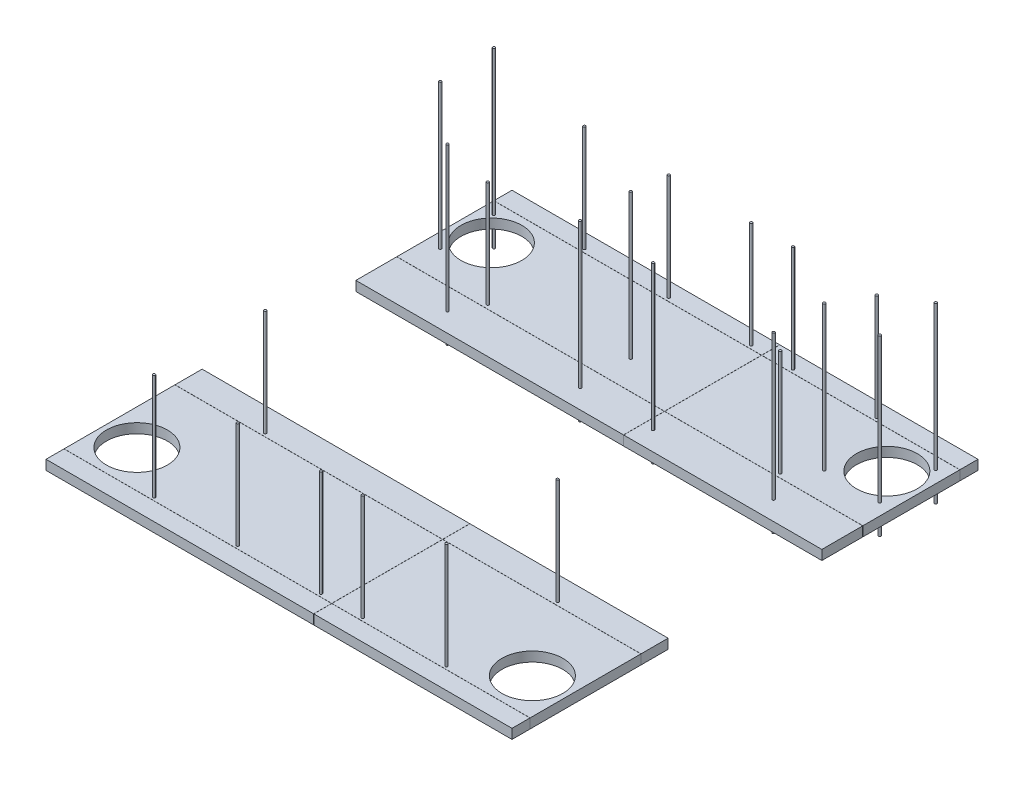
from build123d import *

# Parameters (mm, degrees)
SKETCH1_W                        = 4908.55
SKETCH1_H                        = 4908.55
BOSS_EXTRUDE1_DEPTH              = 101.6
SKETCH2_W                        = 4908.55
SKETCH2_H                        = 1619.25
CUT_EXTRUDE1_DEPTH               = 3473.355700566
SKETCH4_W                        = 4908.55
SKETCH4_H                        = 1.27
CUT_EXTRUDE_THIN1_DEPTH          = 3473.355700566
CUT_EXTRUDE_THIN2_DEPTH          = 3473.355700566
CUT_EXTRUDE_THIN2_DEPTH_BACK     = 3473.355700566
SKETCH5_W                        = 1.27
SKETCH5_H                        = 4908.55
SKETCH6_R                        = 320.675
CUT_EXTRUDE2_DEPTH               = 3473.355700566
STUD_LAYOUT_SKETCH_DEPTH         = 1524
STUD_LAYOUT_SKETCH_DEPTH_BACK    = 304.8
SKETCH7_R                        = 12.7
STUD_LAYOUT_SKETCH_2_DEPTH       = 1524
STUD_LAYOUT_SKETCH_2_DEPTH_BACK  = 304.8
STUD_LAYOUT_SKETCH_3_DEPTH       = 1524
STUD_LAYOUT_SKETCH_3_DEPTH_BACK  = 304.8
STUD_LAYOUT_SKETCH_4_DEPTH       = 1524
STUD_LAYOUT_SKETCH_4_DEPTH_BACK  = 304.8
STUD_LAYOUT_SKETCH_5_DEPTH       = 1524
STUD_LAYOUT_SKETCH_5_DEPTH_BACK  = 304.8
STUD_LAYOUT_SKETCH_6_DEPTH       = 1524
STUD_LAYOUT_SKETCH_6_DEPTH_BACK  = 304.8
STUD_LAYOUT_SKETCH_7_DEPTH       = 1524
STUD_LAYOUT_SKETCH_7_DEPTH_BACK  = 304.8
STUD_LAYOUT_SKETCH_8_DEPTH       = 1524
STUD_LAYOUT_SKETCH_8_DEPTH_BACK  = 304.8
STUD_LAYOUT_SKETCH_9_DEPTH       = 1524
STUD_LAYOUT_SKETCH_9_DEPTH_BACK  = 304.8
STUD_LAYOUT_SKETCH_10_DEPTH      = 1524
STUD_LAYOUT_SKETCH_10_DEPTH_BACK = 304.8
STUD_LAYOUT_SKETCH_11_DEPTH      = 1524
STUD_LAYOUT_SKETCH_11_DEPTH_BACK = 304.8
STUD_LAYOUT_SKETCH_12_DEPTH      = 1524
STUD_LAYOUT_SKETCH_12_DEPTH_BACK = 304.8
STUD_LAYOUT_SKETCH_13_DEPTH      = 1524
STUD_LAYOUT_SKETCH_13_DEPTH_BACK = 304.8
STUD_LAYOUT_SKETCH_14_DEPTH      = 1524
STUD_LAYOUT_SKETCH_14_DEPTH_BACK = 304.8
STUD_LAYOUT_SKETCH_15_DEPTH      = 1524
STUD_LAYOUT_SKETCH_15_DEPTH_BACK = 304.8
STUD_LAYOUT_SKETCH_16_DEPTH      = 1524
STUD_LAYOUT_SKETCH_16_DEPTH_BACK = 304.8
STUD_LAYOUT_SKETCH_17_DEPTH      = 1524
STUD_LAYOUT_SKETCH_17_DEPTH_BACK = 304.8
STUD_LAYOUT_SKETCH_18_DEPTH      = 1524
STUD_LAYOUT_SKETCH_18_DEPTH_BACK = 304.8
STUD_LAYOUT_SKETCH_19_DEPTH      = 1524
STUD_LAYOUT_SKETCH_19_DEPTH_BACK = 304.8
STUD_LAYOUT_SKETCH_20_DEPTH      = 1524
STUD_LAYOUT_SKETCH_20_DEPTH_BACK = 304.8
STUD_LAYOUT_SKETCH_21_DEPTH      = 1524
STUD_LAYOUT_SKETCH_21_DEPTH_BACK = 304.8
STUD_LAYOUT_SKETCH_22_DEPTH      = 1524
STUD_LAYOUT_SKETCH_22_DEPTH_BACK = 304.8
STUD_LAYOUT_SKETCH_23_DEPTH      = 1524
STUD_LAYOUT_SKETCH_23_DEPTH_BACK = 304.8
STUD_LAYOUT_SKETCH_24_DEPTH      = 1524
STUD_LAYOUT_SKETCH_24_DEPTH_BACK = 304.8
SKETCH8_W                        = 5497.787174958
SKETCH8_H                        = 7518.420007062
CUT_EXTRUDE5_DEPTH               = 406.4
SKETCH9_W                        = 5184.868781488
SKETCH9_H                        = 7370.4919608
CUT_EXTRUDE6_DEPTH               = 254


with BuildPart() as part:
    # Sketch1 → Boss-Extrude1 (new body)
    with BuildSketch(Plane(origin=(0, 0, 0), x_dir=(1, 0, 0), z_dir=(0, 1, 0))):
        Rectangle(SKETCH1_W, SKETCH1_H)
    extrude(amount=BOSS_EXTRUDE1_DEPTH)

    # Sketch2 → Cut-Extrude1 (cut, through all)
    with BuildSketch(Plane(origin=(0, 101.6, 0), x_dir=(1, 0, 0), z_dir=(0, 1, 0))):
        Rectangle(SKETCH2_W, SKETCH2_H)
    extrude(amount=-CUT_EXTRUDE1_DEPTH, mode=Mode.SUBTRACT)


with BuildPart() as cut_extrude1_piece_1:
    # of the separate pieces the step leaves, piece 1, a body of its own (cut_extrude1_pieces)
    add(part.part.solids().sort_by_distance((-2454.275, 0, -2454.275))[0])


with BuildPart() as cut_extrude1_piece_2:
    # of the separate pieces the step leaves, piece 2, a body of its own (cut_extrude1_pieces)
    add(part.part.solids().sort_by_distance((-2454.275, 0, 2454.275))[0])


with BuildPart() as cut_extrude_thin1_tool:
    # Sketch4 → Cut-Extrude-Thin1 (new, through all)
    with BuildSketch(Plane(origin=(0, 101.6, 0), x_dir=(1, 0, 0), z_dir=(0, 1, 0))):
        with Locations((0, -2264.41)):
            Rectangle(SKETCH4_W, SKETCH4_H)
        with Locations((0, -1096.01)):
            Rectangle(SKETCH4_W, SKETCH4_H)
        with Locations((0, 2263.14)):
            Rectangle(SKETCH4_W, SKETCH4_H)
        with Locations((0, 1240.79)):
            Rectangle(SKETCH4_W, SKETCH4_H)
    extrude(amount=-CUT_EXTRUDE_THIN1_DEPTH)


with BuildPart() as cut_extrude1_piece_1_1:
    add(cut_extrude1_piece_1.part)

    # Cut-Extrude-Thin1: cut by cut_extrude_thin1_tool
    add(cut_extrude_thin1_tool.part, mode=Mode.SUBTRACT)


with BuildPart() as cut_extrude1_piece_2_1:
    add(cut_extrude1_piece_2.part)

    # Cut-Extrude-Thin1: cut by cut_extrude_thin1_tool
    add(cut_extrude_thin1_tool.part, mode=Mode.SUBTRACT)


with BuildPart() as cut_extrude_thin1_piece_1:
    # of the separate pieces the step leaves, piece 1, a body of its own (cut_extrude_thin1_pieces)
    add(cut_extrude1_piece_1_1.part.solids().sort_by_distance((-2454.275, 0, -1241.425))[0])


with BuildPart() as cut_extrude_thin1_piece_2:
    # of the separate pieces the step leaves, piece 2, a body of its own (cut_extrude_thin1_pieces)
    add(cut_extrude1_piece_1_1.part.solids().sort_by_distance((-2454.275, 0, -809.625))[0])


with BuildPart() as cut_extrude_thin1_piece_3:
    # of the separate pieces the step leaves, piece 3, a body of its own (cut_extrude_thin1_pieces)
    add(cut_extrude1_piece_1_1.part.solids().sort_by_distance((-2454.275, 0, -2454.275))[0])


with BuildPart() as cut_extrude_thin1_piece_1_of_cut_extrude:
    # of the separate pieces the step leaves, piece 1, a body of its own (cut_extrude_thin1_pieces_of_cut_extrude1)
    add(cut_extrude1_piece_2_1.part.solids().sort_by_distance((-2454.275, 0, 2263.775))[0])


with BuildPart() as cut_extrude_thin1_piece_2_of_cut_extrude:
    # of the separate pieces the step leaves, piece 2, a body of its own (cut_extrude_thin1_pieces_of_cut_extrude1)
    add(cut_extrude1_piece_2_1.part.solids().sort_by_distance((-2454.275, 0, 1095.375))[0])


with BuildPart() as cut_extrude_thin1_piece_3_of_cut_extrude:
    # of the separate pieces the step leaves, piece 3, a body of its own (cut_extrude_thin1_pieces_of_cut_extrude1)
    add(cut_extrude1_piece_2_1.part.solids().sort_by_distance((-2454.275, 0, 2454.275))[0])


with BuildPart() as cut_extrude_thin2_tool:
    # Sketch5 → Cut-Extrude-Thin2 (new, two sides: drawn at the far end of the back side and taken through both)
    with BuildSketch(Plane(origin=(0, 101.6, 0), x_dir=(1, 0, 0), z_dir=(0, 1, 0)).offset(-CUT_EXTRUDE_THIN2_DEPTH_BACK)):
        with Locations((365.76, 0)):
            Rectangle(SKETCH5_W, SKETCH5_H)
    extrude(amount=CUT_EXTRUDE_THIN2_DEPTH + CUT_EXTRUDE_THIN2_DEPTH_BACK)


with BuildPart() as cut_extrude_thin1_piece_1_1:
    add(cut_extrude_thin1_piece_1.part)

    # Cut-Extrude-Thin2: cut by cut_extrude_thin2_tool
    add(cut_extrude_thin2_tool.part, mode=Mode.SUBTRACT)


with BuildPart() as cut_extrude_thin1_piece_2_1:
    add(cut_extrude_thin1_piece_2.part)

    # Cut-Extrude-Thin2: cut by cut_extrude_thin2_tool
    add(cut_extrude_thin2_tool.part, mode=Mode.SUBTRACT)


with BuildPart() as cut_extrude_thin1_piece_3_1:
    add(cut_extrude_thin1_piece_3.part)

    # Cut-Extrude-Thin2: cut by cut_extrude_thin2_tool
    add(cut_extrude_thin2_tool.part, mode=Mode.SUBTRACT)


with BuildPart() as cut_extrude_thin1_piece_1_of_cut_extrude_1:
    add(cut_extrude_thin1_piece_1_of_cut_extrude.part)

    # Cut-Extrude-Thin2: cut by cut_extrude_thin2_tool
    add(cut_extrude_thin2_tool.part, mode=Mode.SUBTRACT)


with BuildPart() as cut_extrude_thin1_piece_2_of_cut_extrude_1:
    add(cut_extrude_thin1_piece_2_of_cut_extrude.part)

    # Cut-Extrude-Thin2: cut by cut_extrude_thin2_tool
    add(cut_extrude_thin2_tool.part, mode=Mode.SUBTRACT)


with BuildPart() as cut_extrude_thin1_piece_3_of_cut_extrude_1:
    add(cut_extrude_thin1_piece_3_of_cut_extrude.part)

    # Cut-Extrude-Thin2: cut by cut_extrude_thin2_tool
    add(cut_extrude_thin2_tool.part, mode=Mode.SUBTRACT)


with BuildPart() as cut_extrude_thin2_piece_1:
    # of the separate pieces the step leaves, piece 1, a body of its own (cut_extrude_thin2_pieces)
    add(cut_extrude_thin1_piece_1_1.part.solids().sort_by_distance((-2454.275, 0, -1241.425))[0])


with BuildPart() as cut_extrude_thin2_piece_2:
    # of the separate pieces the step leaves, piece 2, a body of its own (cut_extrude_thin2_pieces)
    add(cut_extrude_thin1_piece_1_1.part.solids().sort_by_distance((2454.275, 0, -2262.505))[0])


with BuildPart() as cut_extrude_thin2_piece_1_of_cut_extrude:
    # of the separate pieces the step leaves, piece 1, a body of its own (cut_extrude_thin2_pieces_of_cut_extrude)
    add(cut_extrude_thin1_piece_2_1.part.solids().sort_by_distance((-2454.275, 0, -809.625))[0])


with BuildPart() as cut_extrude_thin2_piece_2_of_cut_extrude:
    # of the separate pieces the step leaves, piece 2, a body of its own (cut_extrude_thin2_pieces_of_cut_extrude)
    add(cut_extrude_thin1_piece_2_1.part.solids().sort_by_distance((2454.275, 0, -1240.155))[0])


with BuildPart() as cut_extrude_thin2_piece_1_of_cut_ext_2:
    # of the separate pieces the step leaves, piece 1, a body of its own (cut_extrude_thin2_pieces_of_cut_extr_2)
    add(cut_extrude_thin1_piece_3_1.part.solids().sort_by_distance((-2454.275, 0, -2454.275))[0])


with BuildPart() as cut_extrude_thin2_piece_2_of_cut_ext_2:
    # of the separate pieces the step leaves, piece 2, a body of its own (cut_extrude_thin2_pieces_of_cut_extr_2)
    add(cut_extrude_thin1_piece_3_1.part.solids().sort_by_distance((366.395, 0, -2454.275))[0])


with BuildPart() as cut_extrude_thin2_piece_1_of_cut_ext_3:
    # of the separate pieces the step leaves, piece 1, a body of its own (cut_extrude_thin2_pieces_of_cut_extr_3)
    add(cut_extrude_thin1_piece_1_of_cut_extrude_1.part.solids().sort_by_distance((-2454.275, 0, 2263.775))[0])


with BuildPart() as cut_extrude_thin2_piece_2_of_cut_ext_3:
    # of the separate pieces the step leaves, piece 2, a body of its own (cut_extrude_thin2_pieces_of_cut_extr_3)
    add(cut_extrude_thin1_piece_1_of_cut_extrude_1.part.solids().sort_by_distance((2454.275, 0, 1096.645))[0])


with BuildPart() as cut_extrude_thin2_piece_1_of_cut_ext_4:
    # of the separate pieces the step leaves, piece 1, a body of its own (cut_extrude_thin2_pieces_of_cut_extr_4)
    add(cut_extrude_thin1_piece_2_of_cut_extrude_1.part.solids().sort_by_distance((-2454.275, 0, 1095.375))[0])


with BuildPart() as cut_extrude_thin2_piece_2_of_cut_ext_4:
    # of the separate pieces the step leaves, piece 2, a body of its own (cut_extrude_thin2_pieces_of_cut_extr_4)
    add(cut_extrude_thin1_piece_2_of_cut_extrude_1.part.solids().sort_by_distance((2454.275, 0, 809.625))[0])


with BuildPart() as cut_extrude_thin2_piece_1_of_cut_ext_5:
    # of the separate pieces the step leaves, piece 1, a body of its own (cut_extrude_thin2_pieces_of_cut_extr_5)
    add(cut_extrude_thin1_piece_3_of_cut_extrude_1.part.solids().sort_by_distance((-2454.275, 0, 2454.275))[0])


with BuildPart() as cut_extrude_thin2_piece_2_of_cut_ext_5:
    # of the separate pieces the step leaves, piece 2, a body of its own (cut_extrude_thin2_pieces_of_cut_extr_5)
    add(cut_extrude_thin1_piece_3_of_cut_extrude_1.part.solids().sort_by_distance((2454.275, 0, 2265.045))[0])


with BuildPart() as cut_extrude2_tool:
    # Sketch6 → Cut-Extrude2 (new, through all)
    with BuildSketch(Plane(origin=(0, 101.6, 0), x_dir=(1, 0, 0), z_dir=(0, 1, 0))):
        with Locations((2082.8, 1865.63)):
            Circle(SKETCH6_R)
        with Locations((-2082.8, 1865.63)):
            Circle(SKETCH6_R)
        with Locations((-2082.8, -1868.17)):
            Circle(SKETCH6_R)
        with Locations((2082.8, -1868.17)):
            Circle(SKETCH6_R)
    extrude(amount=-CUT_EXTRUDE2_DEPTH)


with BuildPart() as cut_extrude_thin2_piece_1_1:
    add(cut_extrude_thin2_piece_1.part)

    # Cut-Extrude2: cut by cut_extrude2_tool
    add(cut_extrude2_tool.part, mode=Mode.SUBTRACT)


with BuildPart() as cut_extrude_thin2_piece_2_1:
    add(cut_extrude_thin2_piece_2.part)

    # Cut-Extrude2: cut by cut_extrude2_tool
    add(cut_extrude2_tool.part, mode=Mode.SUBTRACT)


with BuildPart() as cut_extrude_thin2_piece_1_of_cut_ext_3_1:
    add(cut_extrude_thin2_piece_1_of_cut_ext_3.part)

    # Cut-Extrude2: cut by cut_extrude2_tool
    add(cut_extrude2_tool.part, mode=Mode.SUBTRACT)


with BuildPart() as cut_extrude_thin2_piece_2_of_cut_ext_3_1:
    add(cut_extrude_thin2_piece_2_of_cut_ext_3.part)

    # Cut-Extrude2: cut by cut_extrude2_tool
    add(cut_extrude2_tool.part, mode=Mode.SUBTRACT)


with BuildPart() as body_13:
    # Sketch7 → STUD LAYOUT SKETCH (new, two sides: drawn at the far end of the back side and taken through both)
    with BuildSketch(Plane(origin=(0, 101.6, 0), x_dir=(1, 0, 0), z_dir=(0, 1, 0)).offset(-STUD_LAYOUT_SKETCH_DEPTH_BACK)):
        with Locations((-1539.875, 2301.875)):
            Circle(SKETCH7_R)
    extrude(amount=STUD_LAYOUT_SKETCH_DEPTH + STUD_LAYOUT_SKETCH_DEPTH_BACK)


with BuildPart() as body_14:
    # Sketch7 → STUD LAYOUT SKETCH 2 (new, two sides: drawn at the far end of the back side and taken through both)
    with BuildSketch(Plane(origin=(0, 101.6, 0), x_dir=(1, 0, 0), z_dir=(0, 1, 0)).offset(-STUD_LAYOUT_SKETCH_2_DEPTH_BACK)):
        with Locations((1743.075, 1546.225)):
            Circle(SKETCH7_R)
    extrude(amount=STUD_LAYOUT_SKETCH_2_DEPTH + STUD_LAYOUT_SKETCH_2_DEPTH_BACK)


with BuildPart() as body_15:
    # Sketch7 → STUD LAYOUT SKETCH 3 (new, two sides: drawn at the far end of the back side and taken through both)
    with BuildSketch(Plane(origin=(0, 101.6, 0), x_dir=(1, 0, 0), z_dir=(0, 1, 0)).offset(-STUD_LAYOUT_SKETCH_3_DEPTH_BACK)):
        with Locations((473.075, 1012.825)):
            Circle(SKETCH7_R)
    extrude(amount=STUD_LAYOUT_SKETCH_3_DEPTH + STUD_LAYOUT_SKETCH_3_DEPTH_BACK)


with BuildPart() as body_16:
    # Sketch7 → STUD LAYOUT SKETCH 4 (new, two sides: drawn at the far end of the back side and taken through both)
    with BuildSketch(Plane(origin=(0, 101.6, 0), x_dir=(1, 0, 0), z_dir=(0, 1, 0)).offset(-STUD_LAYOUT_SKETCH_4_DEPTH_BACK)):
        with Locations((-295.275, 1546.225)):
            Circle(SKETCH7_R)
    extrude(amount=STUD_LAYOUT_SKETCH_4_DEPTH + STUD_LAYOUT_SKETCH_4_DEPTH_BACK)


with BuildPart() as body_17:
    # Sketch7 → STUD LAYOUT SKETCH 5 (new, two sides: drawn at the far end of the back side and taken through both)
    with BuildSketch(Plane(origin=(0, 101.6, 0), x_dir=(1, 0, 0), z_dir=(0, 1, 0)).offset(-STUD_LAYOUT_SKETCH_5_DEPTH_BACK)):
        with Locations((-295.275, 1012.825)):
            Circle(SKETCH7_R)
    extrude(amount=STUD_LAYOUT_SKETCH_5_DEPTH + STUD_LAYOUT_SKETCH_5_DEPTH_BACK)


with BuildPart() as body_18:
    # Sketch7 → STUD LAYOUT SKETCH 6 (new, two sides: drawn at the far end of the back side and taken through both)
    with BuildSketch(Plane(origin=(0, 101.6, 0), x_dir=(1, 0, 0), z_dir=(0, 1, 0)).offset(-STUD_LAYOUT_SKETCH_6_DEPTH_BACK)):
        with Locations((-1692.275, 1012.825)):
            Circle(SKETCH7_R)
    extrude(amount=STUD_LAYOUT_SKETCH_6_DEPTH + STUD_LAYOUT_SKETCH_6_DEPTH_BACK)


with BuildPart() as body_19:
    # Sketch7 → STUD LAYOUT SKETCH 7 (new, two sides: drawn at the far end of the back side and taken through both)
    with BuildSketch(Plane(origin=(0, 101.6, 0), x_dir=(1, 0, 0), z_dir=(0, 1, 0)).offset(-STUD_LAYOUT_SKETCH_7_DEPTH_BACK)):
        with Locations((1743.075, 1012.825)):
            Circle(SKETCH7_R)
    extrude(amount=STUD_LAYOUT_SKETCH_7_DEPTH + STUD_LAYOUT_SKETCH_7_DEPTH_BACK)


with BuildPart() as body_20:
    # Sketch7 → STUD LAYOUT SKETCH 8 (new, two sides: drawn at the far end of the back side and taken through both)
    with BuildSketch(Plane(origin=(0, 101.6, 0), x_dir=(1, 0, 0), z_dir=(0, 1, 0)).offset(-STUD_LAYOUT_SKETCH_8_DEPTH_BACK)):
        with Locations((-2301.875, 1546.225)):
            Circle(SKETCH7_R)
    extrude(amount=STUD_LAYOUT_SKETCH_8_DEPTH + STUD_LAYOUT_SKETCH_8_DEPTH_BACK)


with BuildPart() as body_21:
    # Sketch7 → STUD LAYOUT SKETCH 9 (new, two sides: drawn at the far end of the back side and taken through both)
    with BuildSketch(Plane(origin=(0, 101.6, 0), x_dir=(1, 0, 0), z_dir=(0, 1, 0)).offset(-STUD_LAYOUT_SKETCH_9_DEPTH_BACK)):
        with Locations((2327.275, 1546.225)):
            Circle(SKETCH7_R)
    extrude(amount=STUD_LAYOUT_SKETCH_9_DEPTH + STUD_LAYOUT_SKETCH_9_DEPTH_BACK)


with BuildPart() as body_22:
    # Sketch7 → STUD LAYOUT SKETCH 10 (new, two sides: drawn at the far end of the back side and taken through both)
    with BuildSketch(Plane(origin=(0, 101.6, 0), x_dir=(1, 0, 0), z_dir=(0, 1, 0)).offset(-STUD_LAYOUT_SKETCH_10_DEPTH_BACK)):
        with Locations((-2327.275, 2136.775)):
            Circle(SKETCH7_R)
    extrude(amount=STUD_LAYOUT_SKETCH_10_DEPTH + STUD_LAYOUT_SKETCH_10_DEPTH_BACK)


with BuildPart() as body_23:
    # Sketch7 → STUD LAYOUT SKETCH 11 (new, two sides: drawn at the far end of the back side and taken through both)
    with BuildSketch(Plane(origin=(0, 101.6, 0), x_dir=(1, 0, 0), z_dir=(0, 1, 0)).offset(-STUD_LAYOUT_SKETCH_11_DEPTH_BACK)):
        with Locations((2327.275, 2136.775)):
            Circle(SKETCH7_R)
    extrude(amount=STUD_LAYOUT_SKETCH_11_DEPTH + STUD_LAYOUT_SKETCH_11_DEPTH_BACK)


with BuildPart() as body_24:
    # Sketch7 → STUD LAYOUT SKETCH 12 (new, two sides: drawn at the far end of the back side and taken through both)
    with BuildSketch(Plane(origin=(0, 101.6, 0), x_dir=(1, 0, 0), z_dir=(0, 1, 0)).offset(-STUD_LAYOUT_SKETCH_12_DEPTH_BACK)):
        with Locations((219.075, 2301.875)):
            Circle(SKETCH7_R)
    extrude(amount=STUD_LAYOUT_SKETCH_12_DEPTH + STUD_LAYOUT_SKETCH_12_DEPTH_BACK)


with BuildPart() as body_25:
    # Sketch7 → STUD LAYOUT SKETCH 13 (new, two sides: drawn at the far end of the back side and taken through both)
    with BuildSketch(Plane(origin=(0, 101.6, 0), x_dir=(1, 0, 0), z_dir=(0, 1, 0)).offset(-STUD_LAYOUT_SKETCH_13_DEPTH_BACK)):
        with Locations((658.495, 2301.875)):
            Circle(SKETCH7_R)
    extrude(amount=STUD_LAYOUT_SKETCH_13_DEPTH + STUD_LAYOUT_SKETCH_13_DEPTH_BACK)


with BuildPart() as body_26:
    # Sketch7 → STUD LAYOUT SKETCH 14 (new, two sides: drawn at the far end of the back side and taken through both)
    with BuildSketch(Plane(origin=(0, 101.6, 0), x_dir=(1, 0, 0), z_dir=(0, 1, 0)).offset(-STUD_LAYOUT_SKETCH_14_DEPTH_BACK)):
        with Locations((1539.875, 2301.875)):
            Circle(SKETCH7_R)
    extrude(amount=STUD_LAYOUT_SKETCH_14_DEPTH + STUD_LAYOUT_SKETCH_14_DEPTH_BACK)


with BuildPart() as body_27:
    # Sketch7 → STUD LAYOUT SKETCH 15 (new, two sides: drawn at the far end of the back side and taken through both)
    with BuildSketch(Plane(origin=(0, 101.6, 0), x_dir=(1, 0, 0), z_dir=(0, 1, 0)).offset(-STUD_LAYOUT_SKETCH_15_DEPTH_BACK)):
        with Locations((-650.875, 2301.875)):
            Circle(SKETCH7_R)
    extrude(amount=STUD_LAYOUT_SKETCH_15_DEPTH + STUD_LAYOUT_SKETCH_15_DEPTH_BACK)


with BuildPart() as body_28:
    # Sketch7 → STUD LAYOUT SKETCH 16 (new, two sides: drawn at the far end of the back side and taken through both)
    with BuildSketch(Plane(origin=(0, 101.6, 0), x_dir=(1, 0, 0), z_dir=(0, 1, 0)).offset(-STUD_LAYOUT_SKETCH_16_DEPTH_BACK)):
        with Locations((-1539.875, 1285.875)):
            Circle(SKETCH7_R)
    extrude(amount=STUD_LAYOUT_SKETCH_16_DEPTH + STUD_LAYOUT_SKETCH_16_DEPTH_BACK)


with BuildPart() as body_29:
    # Sketch7 → STUD LAYOUT SKETCH 17 (new, two sides: drawn at the far end of the back side and taken through both)
    with BuildSketch(Plane(origin=(0, 101.6, 0), x_dir=(1, 0, 0), z_dir=(0, 1, 0)).offset(-STUD_LAYOUT_SKETCH_17_DEPTH_BACK)):
        with Locations((1539.875, 1285.875)):
            Circle(SKETCH7_R)
    extrude(amount=STUD_LAYOUT_SKETCH_17_DEPTH + STUD_LAYOUT_SKETCH_17_DEPTH_BACK)


with BuildPart() as body_30:
    # Sketch7 → STUD LAYOUT SKETCH 18 (new, two sides: drawn at the far end of the back side and taken through both)
    with BuildSketch(Plane(origin=(0, 101.6, 0), x_dir=(1, 0, 0), z_dir=(0, 1, 0)).offset(-STUD_LAYOUT_SKETCH_18_DEPTH_BACK)):
        with Locations((-1539.875, -1058.595975439)):
            Circle(SKETCH7_R)
    extrude(amount=STUD_LAYOUT_SKETCH_18_DEPTH + STUD_LAYOUT_SKETCH_18_DEPTH_BACK)


with BuildPart() as body_31:
    # Sketch7 → STUD LAYOUT SKETCH 19 (new, two sides: drawn at the far end of the back side and taken through both)
    with BuildSketch(Plane(origin=(0, 101.6, 0), x_dir=(1, 0, 0), z_dir=(0, 1, 0)).offset(-STUD_LAYOUT_SKETCH_19_DEPTH_BACK)):
        with Locations((-1539.875, -2230.249923642)):
            Circle(SKETCH7_R)
    extrude(amount=STUD_LAYOUT_SKETCH_19_DEPTH + STUD_LAYOUT_SKETCH_19_DEPTH_BACK)


with BuildPart() as body_32:
    # Sketch7 → STUD LAYOUT SKETCH 20 (new, two sides: drawn at the far end of the back side and taken through both)
    with BuildSketch(Plane(origin=(0, 101.6, 0), x_dir=(1, 0, 0), z_dir=(0, 1, 0)).offset(-STUD_LAYOUT_SKETCH_20_DEPTH_BACK)):
        with Locations((-658.765974284, -2230.249923642)):
            Circle(SKETCH7_R)
    extrude(amount=STUD_LAYOUT_SKETCH_20_DEPTH + STUD_LAYOUT_SKETCH_20_DEPTH_BACK)


with BuildPart() as body_33:
    # Sketch7 → STUD LAYOUT SKETCH 21 (new, two sides: drawn at the far end of the back side and taken through both)
    with BuildSketch(Plane(origin=(0, 101.6, 0), x_dir=(1, 0, 0), z_dir=(0, 1, 0)).offset(-STUD_LAYOUT_SKETCH_21_DEPTH_BACK)):
        with Locations((219.075, -2230.249923642)):
            Circle(SKETCH7_R)
    extrude(amount=STUD_LAYOUT_SKETCH_21_DEPTH + STUD_LAYOUT_SKETCH_21_DEPTH_BACK)


with BuildPart() as body_34:
    # Sketch7 → STUD LAYOUT SKETCH 22 (new, two sides: drawn at the far end of the back side and taken through both)
    with BuildSketch(Plane(origin=(0, 101.6, 0), x_dir=(1, 0, 0), z_dir=(0, 1, 0)).offset(-STUD_LAYOUT_SKETCH_22_DEPTH_BACK)):
        with Locations((658.495, -2230.249923642)):
            Circle(SKETCH7_R)
    extrude(amount=STUD_LAYOUT_SKETCH_22_DEPTH + STUD_LAYOUT_SKETCH_22_DEPTH_BACK)


with BuildPart() as body_35:
    # Sketch7 → STUD LAYOUT SKETCH 23 (new, two sides: drawn at the far end of the back side and taken through both)
    with BuildSketch(Plane(origin=(0, 101.6, 0), x_dir=(1, 0, 0), z_dir=(0, 1, 0)).offset(-STUD_LAYOUT_SKETCH_23_DEPTH_BACK)):
        with Locations((1539.875, -2230.249923642)):
            Circle(SKETCH7_R)
    extrude(amount=STUD_LAYOUT_SKETCH_23_DEPTH + STUD_LAYOUT_SKETCH_23_DEPTH_BACK)


with BuildPart() as body_36:
    # Sketch7 → STUD LAYOUT SKETCH 24 (new, two sides: drawn at the far end of the back side and taken through both)
    with BuildSketch(Plane(origin=(0, 101.6, 0), x_dir=(1, 0, 0), z_dir=(0, 1, 0)).offset(-STUD_LAYOUT_SKETCH_24_DEPTH_BACK)):
        with Locations((1539.875, -1058.595975439)):
            Circle(SKETCH7_R)
    extrude(amount=STUD_LAYOUT_SKETCH_24_DEPTH + STUD_LAYOUT_SKETCH_24_DEPTH_BACK)


with BuildPart() as cut_extrude5_tool:
    # Sketch8 → Cut-Extrude5 (new body)
    with BuildSketch(Plane(origin=(0, 1625.6, 0), x_dir=(1, 0, 0), z_dir=(0, 1, 0))):
        Rectangle(SKETCH8_W, SKETCH8_H)
    extrude(amount=-CUT_EXTRUDE5_DEPTH)


with BuildPart() as body_13_1:
    add(body_13.part)

    # Cut-Extrude5: cut by cut_extrude5_tool
    add(cut_extrude5_tool.part, mode=Mode.SUBTRACT)


with BuildPart() as body_24_1:
    add(body_24.part)

    # Cut-Extrude5: cut by cut_extrude5_tool
    add(cut_extrude5_tool.part, mode=Mode.SUBTRACT)


with BuildPart() as body_25_1:
    add(body_25.part)

    # Cut-Extrude5: cut by cut_extrude5_tool
    add(cut_extrude5_tool.part, mode=Mode.SUBTRACT)


with BuildPart() as body_26_1:
    add(body_26.part)

    # Cut-Extrude5: cut by cut_extrude5_tool
    add(cut_extrude5_tool.part, mode=Mode.SUBTRACT)


with BuildPart() as body_27_1:
    add(body_27.part)

    # Cut-Extrude5: cut by cut_extrude5_tool
    add(cut_extrude5_tool.part, mode=Mode.SUBTRACT)


with BuildPart() as body_28_1:
    add(body_28.part)

    # Cut-Extrude5: cut by cut_extrude5_tool
    add(cut_extrude5_tool.part, mode=Mode.SUBTRACT)


with BuildPart() as body_29_1:
    add(body_29.part)

    # Cut-Extrude5: cut by cut_extrude5_tool
    add(cut_extrude5_tool.part, mode=Mode.SUBTRACT)


with BuildPart() as body_30_1:
    add(body_30.part)

    # Cut-Extrude5: cut by cut_extrude5_tool
    add(cut_extrude5_tool.part, mode=Mode.SUBTRACT)


with BuildPart() as body_31_1:
    add(body_31.part)

    # Cut-Extrude5: cut by cut_extrude5_tool
    add(cut_extrude5_tool.part, mode=Mode.SUBTRACT)


with BuildPart() as body_32_1:
    add(body_32.part)

    # Cut-Extrude5: cut by cut_extrude5_tool
    add(cut_extrude5_tool.part, mode=Mode.SUBTRACT)


with BuildPart() as body_33_1:
    add(body_33.part)

    # Cut-Extrude5: cut by cut_extrude5_tool
    add(cut_extrude5_tool.part, mode=Mode.SUBTRACT)


with BuildPart() as body_34_1:
    add(body_34.part)

    # Cut-Extrude5: cut by cut_extrude5_tool
    add(cut_extrude5_tool.part, mode=Mode.SUBTRACT)


with BuildPart() as body_35_1:
    add(body_35.part)

    # Cut-Extrude5: cut by cut_extrude5_tool
    add(cut_extrude5_tool.part, mode=Mode.SUBTRACT)


with BuildPart() as body_36_1:
    add(body_36.part)

    # Cut-Extrude5: cut by cut_extrude5_tool
    add(cut_extrude5_tool.part, mode=Mode.SUBTRACT)


with BuildPart() as cut_extrude6_tool:
    # Sketch9 → Cut-Extrude6 (new body)
    with BuildSketch(Plane.XZ.offset(203.2)):
        Rectangle(SKETCH9_W, SKETCH9_H)
    extrude(amount=-CUT_EXTRUDE6_DEPTH)


with BuildPart() as body_13_2:
    add(body_13_1.part)

    # Cut-Extrude6: cut by cut_extrude6_tool
    add(cut_extrude6_tool.part, mode=Mode.SUBTRACT)


with BuildPart() as body_24_2:
    add(body_24_1.part)

    # Cut-Extrude6: cut by cut_extrude6_tool
    add(cut_extrude6_tool.part, mode=Mode.SUBTRACT)


with BuildPart() as body_25_2:
    add(body_25_1.part)

    # Cut-Extrude6: cut by cut_extrude6_tool
    add(cut_extrude6_tool.part, mode=Mode.SUBTRACT)


with BuildPart() as body_26_2:
    add(body_26_1.part)

    # Cut-Extrude6: cut by cut_extrude6_tool
    add(cut_extrude6_tool.part, mode=Mode.SUBTRACT)


with BuildPart() as body_27_2:
    add(body_27_1.part)

    # Cut-Extrude6: cut by cut_extrude6_tool
    add(cut_extrude6_tool.part, mode=Mode.SUBTRACT)


with BuildPart() as body_28_2:
    add(body_28_1.part)

    # Cut-Extrude6: cut by cut_extrude6_tool
    add(cut_extrude6_tool.part, mode=Mode.SUBTRACT)


with BuildPart() as body_29_2:
    add(body_29_1.part)

    # Cut-Extrude6: cut by cut_extrude6_tool
    add(cut_extrude6_tool.part, mode=Mode.SUBTRACT)


with BuildPart() as body_30_2:
    add(body_30_1.part)

    # Cut-Extrude6: cut by cut_extrude6_tool
    add(cut_extrude6_tool.part, mode=Mode.SUBTRACT)


with BuildPart() as body_31_2:
    add(body_31_1.part)

    # Cut-Extrude6: cut by cut_extrude6_tool
    add(cut_extrude6_tool.part, mode=Mode.SUBTRACT)


with BuildPart() as body_32_2:
    add(body_32_1.part)

    # Cut-Extrude6: cut by cut_extrude6_tool
    add(cut_extrude6_tool.part, mode=Mode.SUBTRACT)


with BuildPart() as body_33_2:
    add(body_33_1.part)

    # Cut-Extrude6: cut by cut_extrude6_tool
    add(cut_extrude6_tool.part, mode=Mode.SUBTRACT)


with BuildPart() as body_34_2:
    add(body_34_1.part)

    # Cut-Extrude6: cut by cut_extrude6_tool
    add(cut_extrude6_tool.part, mode=Mode.SUBTRACT)


with BuildPart() as body_35_2:
    add(body_35_1.part)

    # Cut-Extrude6: cut by cut_extrude6_tool
    add(cut_extrude6_tool.part, mode=Mode.SUBTRACT)


with BuildPart() as body_36_2:
    add(body_36_1.part)

    # Cut-Extrude6: cut by cut_extrude6_tool
    add(cut_extrude6_tool.part, mode=Mode.SUBTRACT)


solid = Compound([cut_extrude_thin2_piece_1_of_cut_extrude.part, cut_extrude_thin2_piece_2_of_cut_extrude.part, cut_extrude_thin2_piece_1_of_cut_ext_2.part, cut_extrude_thin2_piece_2_of_cut_ext_2.part, cut_extrude_thin2_piece_1_of_cut_ext_4.part, cut_extrude_thin2_piece_2_of_cut_ext_4.part, cut_extrude_thin2_piece_1_of_cut_ext_5.part, cut_extrude_thin2_piece_2_of_cut_ext_5.part, cut_extrude_thin2_piece_1_1.part, cut_extrude_thin2_piece_2_1.part, cut_extrude_thin2_piece_1_of_cut_ext_3_1.part, cut_extrude_thin2_piece_2_of_cut_ext_3_1.part, body_14.part, body_15.part, body_16.part, body_17.part, body_18.part, body_19.part, body_20.part, body_21.part, body_22.part, body_23.part, body_13_2.part, body_24_2.part, body_25_2.part, body_26_2.part, body_27_2.part, body_28_2.part, body_29_2.part, body_30_2.part, body_31_2.part, body_32_2.part, body_33_2.part, body_34_2.part, body_35_2.part, body_36_2.part])
